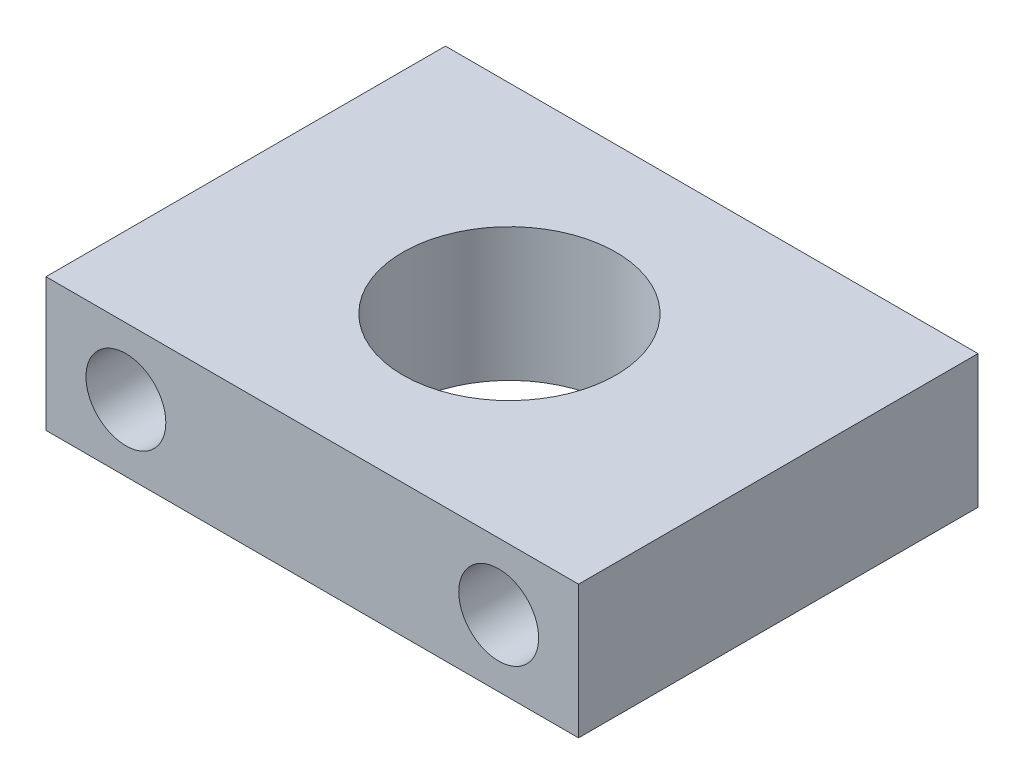
from build123d import *

# Parameters (mm, degrees)
SKETCH1_W           = 20
SKETCH1_H           = 15
BOSS_EXTRUDE1_DEPTH = 5
SKETCH2_R           = 1.5
CUT_EXTRUDE1_DEPTH  = 24.203994107
SKETCH3_R           = 4
CUT_EXTRUDE2_DEPTH  = 5


with BuildPart() as part:
    # Sketch1 → Boss-Extrude1 (new body)
    with BuildSketch(Plane(origin=(0, 0, 0), x_dir=(1, 0, 0), z_dir=(0, 1, 0))):
        with Locations((-6.983089899, -4.822749115)):
            Rectangle(SKETCH1_W, SKETCH1_H)
    extrude(amount=BOSS_EXTRUDE1_DEPTH)

    # Sketch2 → Cut-Extrude1 (cut, through all)
    with BuildSketch(Plane.XY.offset(12.322749115)):
        with Locations((-13.983089899, 2.5)):
            Circle(SKETCH2_R)
        with Locations((0.016910101, 2.5)):
            Circle(SKETCH2_R)
    extrude(amount=-CUT_EXTRUDE1_DEPTH, mode=Mode.SUBTRACT)

    # Sketch3 → Cut-Extrude2 (cut)
    with BuildSketch(Plane(origin=(0, 5, 0), x_dir=(1, 0, 0), z_dir=(0, 1, 0))):
        with Locations((-7.080321074, -4.822749115)):
            Circle(SKETCH3_R)
    extrude(amount=-CUT_EXTRUDE2_DEPTH, mode=Mode.SUBTRACT)


solid = part.part
